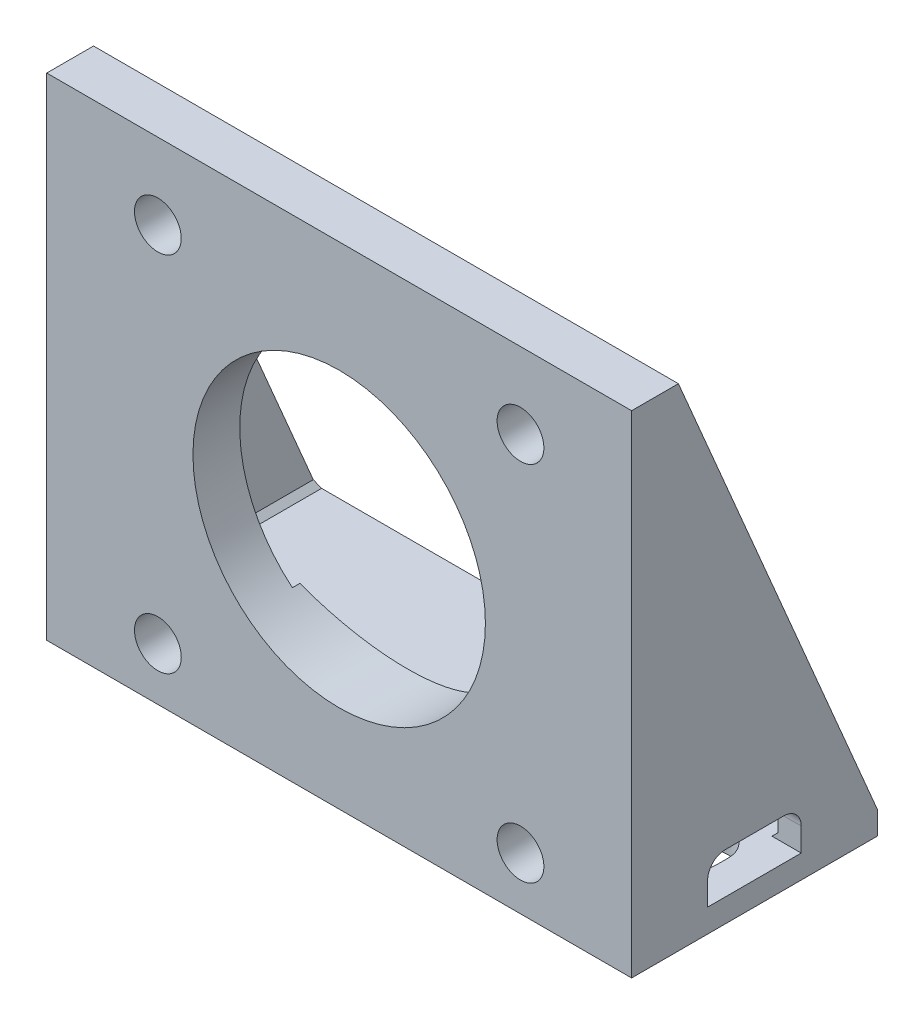
from build123d import *
from OCP.BRepFilletAPI import BRepFilletAPI_MakeChamfer

# Parameters (mm, degrees)
SKETCH1_W                  = 50
SKETCH1_H                  = 21
BASE_DEPTH                 = 2
SKETCH2_W                  = 50
SKETCH2_H                  = 42
SKETCH2_R                  = 2
SKETCH2_R_2                = 12.5
ENCAIXE_MOTOR_DEPTH        = 4
LATERAIS_START             = -50
LATERAIS_BLOCO_DEPTH       = 50
LATERAIS_START_2           = -17
SKETCH4_W                  = 46
SKETCH4_H                  = 40
LATERAIS_CORTE_DEPTH       = 17
SUPORTE_CENTRAL_DEPTH      = 8
SUPORTE_CENTRAL_DEPTH_BACK = 8
SKETCH6_R                  = 12.5
FURO_MOTOR_25_DEPTH        = 68.475921631
CHANFROS_1X45_SIZE         = 0.5
CHANFROS_1X45_SIZE_2       = 0.897527468
CHANFROS_2X45_SIZE         = 2


# Some blends are built 0.0001 mm under size
with BuildPart() as part:
    # Sketch1 → Base (new body)
    with BuildSketch(Plane(origin=(0, 0, 0), x_dir=(1, 0, 0), z_dir=(0, 1, 0))):
        with Locations((25, 10.5)):
            Rectangle(SKETCH1_W, SKETCH1_H)
        with BuildLine():
            Line((7.25, 11), (7.25, 10))
            ThreePointArc((7.25, 10), (5, 7.75), (2.75, 10))
            Line((2.75, 10), (2.75, 11))
            ThreePointArc((2.75, 11), (5, 13.25), (7.25, 11))
        make_face(mode=Mode.SUBTRACT)
        with BuildLine():
            Line((42.75, 11), (42.75, 10))
            ThreePointArc((42.75, 10), (45, 7.75), (47.25, 10))
            Line((47.25, 10), (47.25, 11))
            ThreePointArc((47.25, 11), (45, 13.25), (42.75, 11))
        make_face(mode=Mode.SUBTRACT)
        with BuildLine():
            Line((27.25, 16), (27.25, 15))
            ThreePointArc((27.25, 15), (25, 12.75), (22.75, 15))
            Line((22.75, 15), (22.75, 16))
            ThreePointArc((22.75, 16), (25, 18.25), (27.25, 16))
        make_face(mode=Mode.SUBTRACT)
    extrude(amount=BASE_DEPTH)

    # Sketch2 → Encaixe Motor (add)
    with BuildSketch(Plane.XY):
        with Locations((25, 21)):
            Rectangle(SKETCH2_W, SKETCH2_H)
        with Locations((9.5, 35.5)):
            Circle(SKETCH2_R, mode=Mode.SUBTRACT)
        with Locations((9.5, 4.5)):
            Circle(SKETCH2_R, mode=Mode.SUBTRACT)
        with Locations((40.5, 4.5)):
            Circle(SKETCH2_R, mode=Mode.SUBTRACT)
        with Locations((40.5, 35.5)):
            Circle(SKETCH2_R, mode=Mode.SUBTRACT)
        with Locations((25, 20)):
            Circle(SKETCH2_R_2, mode=Mode.SUBTRACT)
    extrude(amount=-ENCAIXE_MOTOR_DEPTH)

    # Sketch3 → Laterais - Bloco (add)
    with BuildSketch(Plane(origin=(50, 0, 0), x_dir=(0, 0, -1), z_dir=(1, 0, 0)).offset(LATERAIS_START)):
        with BuildLine():
            Line((21, 2), (4, 42))
            Line((4, 42), (4, 2))
            Line((4, 2), (6.5, 2))
            Line((6.5, 2), (6.5, 4))
            ThreePointArc((6.5, 4), (6.939339828, 5.060660172), (8, 5.5))
            Line((8, 5.5), (13, 5.5))
            ThreePointArc((13, 5.5), (14.060660172, 5.060660172), (14.5, 4))
            Line((14.5, 4), (14.5, 2))
            Line((14.5, 2), (21, 2))
        make_face()
    extrude(amount=LATERAIS_BLOCO_DEPTH)

    # Sketch4 → Laterais - Corte (cut)
    with BuildSketch(Plane(origin=(0, 0, -21), x_dir=(-1, 0, 0), z_dir=(0, 0, -1)).offset(LATERAIS_START_2)):
        with Locations((-25, 22)):
            Rectangle(SKETCH4_W, SKETCH4_H)
    extrude(amount=LATERAIS_CORTE_DEPTH, mode=Mode.SUBTRACT)

    # Sketch5 → Suporte Central (add, two sides: drawn at the far end of the back side and taken through both)
    with BuildSketch(Plane.ZY.offset(-25).offset(-SUPORTE_CENTRAL_DEPTH_BACK)):
        Polygon((-4, 2), (-8, 2), (-4, 12), align=None)
    extrude(amount=SUPORTE_CENTRAL_DEPTH + SUPORTE_CENTRAL_DEPTH_BACK)

    # Sketch6 → Furo Motor Ø25 (cut, through all)
    with BuildSketch(Plane.XY.offset(-4)):
        with Locations((25, 20)):
            Circle(SKETCH6_R)
    extrude(amount=-FURO_MOTOR_25_DEPTH, mode=Mode.SUBTRACT)

    # Chanfros 1x45°
    chanfros_1x45_edges_1 = [part.edges().sort_by_distance(p)[0] for p in [
        (2, 2, -17.75),
        (48, 2, -17.75),
        (48, 2, -5.25),
        (40.5, 2, -4),
        (2, 2, -5.25),
        (9.5, 2, -4),
        (33, 2, -6),
        (17, 2, -6),
    ]]
    chanfros_1x45_edges_2 = [part.edges().sort_by_distance(p)[0] for p in [
        (25, 2, -8),
    ]]
    chanfros_1x45_side_2 = [part.faces().sort_by_distance(p)[0] for p in [
        (25, 2, -8.01),
    ]]
    chanfros_1x45 = BRepFilletAPI_MakeChamfer(part.part.solid().wrapped)
    for e in chanfros_1x45_edges_1:
        chanfros_1x45.Add(CHANFROS_1X45_SIZE - 0.0001, e.wrapped)
    for e in chanfros_1x45_edges_2:
        chanfros_1x45.Add(CHANFROS_1X45_SIZE - 0.0001, CHANFROS_1X45_SIZE_2 - 0.0001, e.wrapped, chanfros_1x45_side_2[0].wrapped)
    add(Compound.cast(chanfros_1x45.Shape()), mode=Mode.REPLACE)  # a hair under: the kernel refuses the full size

    # Chanfros 2x45°
    # the kernel refuses this chamfer: 2 mm, written as the material it adds along each edge
    with BuildSketch(Plane(origin=(48, 42, -4), x_dir=(-0.9996219169112968, 0, 0.027495876610586726), z_dir=(0, -1, 0))) as chanfros_2x45_piece_1_section:
        Polygon((CHANFROS_2X45_SIZE * 0.999621916911, CHANFROS_2X45_SIZE * 0.0274958766106), (-CHANFROS_2X45_SIZE * 0.0274958766106, CHANFROS_2X45_SIZE * 0.999621916911), (0, 0), align=None)
    chanfros_2x45_piece_1 = extrude(amount=44.643465976, mode=Mode.PRIVATE)
    chanfros_2x45_piece_1 = split(chanfros_2x45_piece_1, bisect_by=Plane(origin=(47.331403888, 24.268482908, -11.535894764), z_dir=(0, -0.3911406403448519, 0.9203309184584747)), keep=Keep.TOP, mode=Mode.PRIVATE)
    chanfros_2x45_piece_1 = split(chanfros_2x45_piece_1, bisect_by=Plane(origin=(47.331403888, 11.597453936, 5.097553936), z_dir=(0, 0.7071067811865476, -0.7071067811865476)), keep=Keep.TOP, mode=Mode.PRIVATE)
    chanfros_2x45_piece_1 = split(chanfros_2x45_piece_1, bisect_by=Plane(origin=(57.08562089, 11.58552089, -4.64473002), z_dir=(-0.70710678118655, 0.707106781186545, 0)), keep=Keep.TOP, mode=Mode.PRIVATE)
    add(chanfros_2x45_piece_1)
    with BuildSketch(Plane(origin=(48, 42, -4), x_dir=(-0.9996219169112968, 0, 0.027495876610586726), z_dir=(0, -1, 0))) as chanfros_2x45_piece_2_section:
        Polygon((CHANFROS_2X45_SIZE * 0.999621916911, CHANFROS_2X45_SIZE * 0.0274958766106), (-CHANFROS_2X45_SIZE * 0.0274958766106, CHANFROS_2X45_SIZE * 0.999621916911), (0, 0), align=None)
    chanfros_2x45_piece_2 = extrude(amount=44.643465976, mode=Mode.PRIVATE)
    chanfros_2x45_piece_2 = split(chanfros_2x45_piece_2, bisect_by=Plane(origin=(47.794441496, 1.480569573, -5.019330427), z_dir=(0, 0.7071067811865476, -0.7071067811865476)), keep=Keep.TOP, mode=Mode.PRIVATE)
    chanfros_2x45_piece_2 = split(chanfros_2x45_piece_2, bisect_by=Plane(origin=(47.523184188, 2.023084188, -5.290587735), z_dir=(0.70710678118655, -0.707106781186545, 0)), keep=Keep.TOP, mode=Mode.PRIVATE)
    add(chanfros_2x45_piece_2)
    with BuildSketch(Plane(origin=(48, 42, -4), x_dir=(-0.9996219169112968, 0, 0.027495876610586726), z_dir=(0, -1, 0))) as chanfros_2x45_piece_3_section:
        Polygon((CHANFROS_2X45_SIZE * 0.999621916911, CHANFROS_2X45_SIZE * 0.0274958766106), (-CHANFROS_2X45_SIZE * 0.0274958766106, CHANFROS_2X45_SIZE * 0.999621916911), (0, 0), align=None)
    chanfros_2x45_piece_3 = extrude(amount=44.643465976, mode=Mode.PRIVATE)
    chanfros_2x45_piece_3 = split(chanfros_2x45_piece_3, bisect_by=Plane(origin=(46.709412265, 2.023084188, -4.476815812), z_dir=(0, -0.7071067811865476, 0.7071067811865476)), keep=Keep.TOP, mode=Mode.PRIVATE)
    chanfros_2x45_piece_3 = split(chanfros_2x45_piece_3, bisect_by=Plane(origin=(46.980669573, 1.480569573, -4.205558504), z_dir=(-0.70710678118655, 0.707106781186545, 0)), keep=Keep.TOP, mode=Mode.PRIVATE)
    add(chanfros_2x45_piece_3)
    with BuildSketch(Plane(origin=(2, -2.643465976, -4), x_dir=(0.9996219169112968, 0, 0.027495876610585838), z_dir=(0, 1, 0))) as chanfros_2x45_piece_4_section:
        Polygon((CHANFROS_2X45_SIZE * 0.999621916911, CHANFROS_2X45_SIZE * 0.0274958766106), (-CHANFROS_2X45_SIZE * 0.0274958766106, CHANFROS_2X45_SIZE * 0.999621916911), (0, 0), align=None)
    chanfros_2x45_piece_4 = extrude(amount=44.643465976, mode=Mode.PRIVATE)
    chanfros_2x45_piece_4 = split(chanfros_2x45_piece_4, bisect_by=Plane(origin=(2.205558504, 1.480569573, -5.019330427), z_dir=(0, 0.7071067811865476, -0.7071067811865476)), keep=Keep.TOP, mode=Mode.PRIVATE)
    chanfros_2x45_piece_4 = split(chanfros_2x45_piece_4, bisect_by=Plane(origin=(2.476815812, 2.023084188, -5.290587735), z_dir=(-0.7071067811865479, -0.7071067811865472, 0)), keep=Keep.TOP, mode=Mode.PRIVATE)
    add(chanfros_2x45_piece_4)
    with BuildSketch(Plane(origin=(2, -2.643465976, -4), x_dir=(0.9996219169112968, 0, 0.027495876610585838), z_dir=(0, 1, 0))) as chanfros_2x45_piece_5_section:
        Polygon((CHANFROS_2X45_SIZE * 0.999621916911, CHANFROS_2X45_SIZE * 0.0274958766106), (-CHANFROS_2X45_SIZE * 0.0274958766106, CHANFROS_2X45_SIZE * 0.999621916911), (0, 0), align=None)
    chanfros_2x45_piece_5 = extrude(amount=44.643465976, mode=Mode.PRIVATE)
    chanfros_2x45_piece_5 = split(chanfros_2x45_piece_5, bisect_by=Plane(origin=(3.290587735, 2.023084188, -4.476815812), z_dir=(0, -0.7071067811865476, 0.7071067811865476)), keep=Keep.TOP, mode=Mode.PRIVATE)
    chanfros_2x45_piece_5 = split(chanfros_2x45_piece_5, bisect_by=Plane(origin=(3.019330427, 1.480569573, -4.205558504), z_dir=(0.7071067811865479, 0.7071067811865472, 0)), keep=Keep.TOP, mode=Mode.PRIVATE)
    add(chanfros_2x45_piece_5)
    with BuildSketch(Plane(origin=(2, -2.643465976, -4), x_dir=(0.9996219169112968, 0, 0.027495876610585838), z_dir=(0, 1, 0))) as chanfros_2x45_piece_6_section:
        Polygon((CHANFROS_2X45_SIZE * 0.999621916911, CHANFROS_2X45_SIZE * 0.0274958766106), (-CHANFROS_2X45_SIZE * 0.0274958766106, CHANFROS_2X45_SIZE * 0.999621916911), (0, 0), align=None)
    chanfros_2x45_piece_6 = extrude(amount=44.643465976, mode=Mode.PRIVATE)
    chanfros_2x45_piece_6 = split(chanfros_2x45_piece_6, bisect_by=Plane(origin=(2.668596112, 11.597453936, 5.097553936), z_dir=(0, 0.7071067811865476, -0.7071067811865476)), keep=Keep.TOP, mode=Mode.PRIVATE)
    chanfros_2x45_piece_6 = split(chanfros_2x45_piece_6, bisect_by=Plane(origin=(-7.08562089, 11.58552089, -4.64473002), z_dir=(0.7071067811865479, 0.7071067811865472, 0)), keep=Keep.TOP, mode=Mode.PRIVATE)
    chanfros_2x45_piece_6 = split(chanfros_2x45_piece_6, bisect_by=Plane(origin=(2.668596112, 24.268482908, -11.535894764), z_dir=(0, -0.3911406403448519, 0.9203309184584747)), keep=Keep.TOP, mode=Mode.PRIVATE)
    add(chanfros_2x45_piece_6)


solid = part.part
